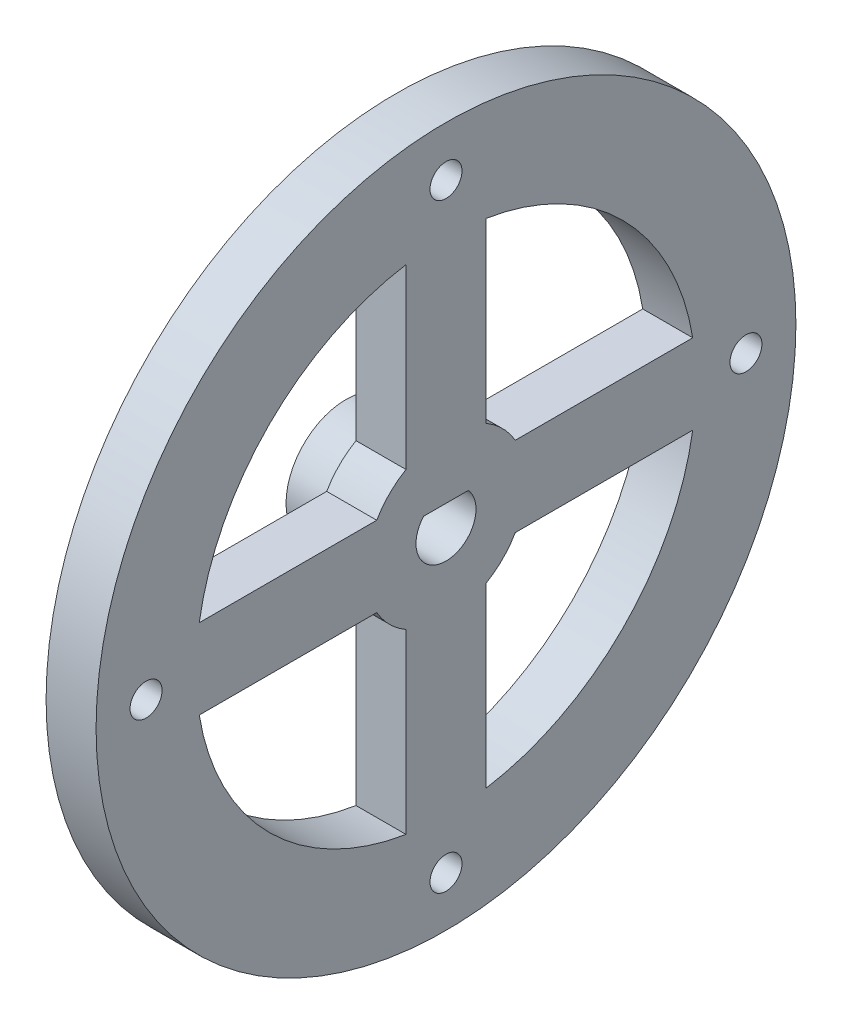
from build123d import *

# Parameters (mm, degrees)
SKETCH1_R           = 35
BOSS_EXTRUDE1_DEPTH = 5
SKETCH2_R           = 1.6
CUT_EXTRUDE1_DEPTH  = 50.749371855
BOSS_EXTRUDE2_START = 5
SKETCH3_R           = 6
BOSS_EXTRUDE2_DEPTH = 5
SKETCH6_R           = 3
CUT_EXTRUDE2_DEPTH  = 2
CUT_EXTRUDE3_DEPTH  = 2.3876


with BuildPart() as part:
    # Sketch1 → Boss-Extrude1 (new body)
    with BuildSketch(Plane(origin=(0, 0, 0), x_dir=(0, 0, -1), z_dir=(1, 0, 0))):
        Circle(SKETCH1_R)
        with BuildLine():
            Line((4, 6.92820323), (4, 24.677925359))
            ThreePointArc((4, 24.677925359), (17.67766953, 17.67766953), (24.677925359, 4))
            Line((24.677925359, 4), (6.92820323, 4))
            ThreePointArc((6.92820323, 4), (5.656854249, 5.656854249), (4, 6.92820323))
        make_face(mode=Mode.SUBTRACT)
        with BuildLine():
            Line((-4, 24.677925359), (-4, 6.92820323))
            ThreePointArc((-4, 6.92820323), (-5.656854249, 5.656854249), (-6.92820323, 4))
            Line((-6.92820323, 4), (-24.677925359, 4))
            ThreePointArc((-24.677925359, 4), (-17.67766953, 17.67766953), (-4, 24.677925359))
        make_face(mode=Mode.SUBTRACT)
        with BuildLine():
            Line((-24.677925359, -4), (-6.92820323, -4))
            ThreePointArc((-6.92820323, -4), (-5.656854249, -5.656854249), (-4, -6.92820323))
            Line((-4, -6.92820323), (-4, -24.677925359))
            ThreePointArc((-4, -24.677925359), (-17.67766953, -17.67766953), (-24.677925359, -4))
        make_face(mode=Mode.SUBTRACT)
        with BuildLine():
            Line((4, -24.677925359), (4, -6.92820323))
            ThreePointArc((4, -6.92820323), (5.656854249, -5.656854249), (6.92820323, -4))
            Line((6.92820323, -4), (24.677925359, -4))
            ThreePointArc((24.677925359, -4), (17.67766953, -17.67766953), (4, -24.677925359))
        make_face(mode=Mode.SUBTRACT)
        with BuildLine():
            Line((2.236067977, 2), (-2.236067977, 2))
            ThreePointArc((-2.236067977, 2), (0, -3), (2.236067977, 2))
        make_face(mode=Mode.SUBTRACT)
    extrude(amount=BOSS_EXTRUDE1_DEPTH)

    # Sketch2 → Cut-Extrude1 (cut, through all)
    with BuildSketch(Plane.ZY):
        with Locations((0, 30)):
            Circle(SKETCH2_R)
        with Locations((30, 0)):
            Circle(SKETCH2_R)
        with Locations((0, -30)):
            Circle(SKETCH2_R)
        with Locations((-30, 0)):
            Circle(SKETCH2_R)
    extrude(amount=-CUT_EXTRUDE1_DEPTH, mode=Mode.SUBTRACT)

    # Sketch3 → Boss-Extrude2 (add)
    with BuildSketch(Plane.ZY.offset(BOSS_EXTRUDE2_START)):
        Circle(SKETCH3_R)
        with BuildLine():
            Line((-2.236067977, 2), (2.236067977, 2))
            ThreePointArc((2.236067977, 2), (0, -3), (-2.236067977, 2))
        make_face(mode=Mode.SUBTRACT)
    extrude(amount=-BOSS_EXTRUDE2_DEPTH)

    # Sketch6 → Cut-Extrude2 (cut)
    with BuildSketch(Plane.ZY):
        with Locations((0, 30)):
            Circle(SKETCH6_R)
        with Locations((30, 0)):
            Circle(SKETCH6_R)
        with Locations((0, -30)):
            Circle(SKETCH6_R)
        with Locations((-30, 0)):
            Circle(SKETCH6_R)
    extrude(amount=-CUT_EXTRUDE2_DEPTH, mode=Mode.SUBTRACT)

    # Sketch7 → Cut-Extrude3 (cut)
    with BuildSketch(Plane.ZY.offset(5)):
        with BuildLine():
            Line((-3.9116, -3.300656457), (-3.9116, 3.300656457))
            ThreePointArc((-3.9116, 3.300656457), (0, 5.1181), (3.9116, 3.300656457))
            Line((3.9116, 3.300656457), (3.9116, -3.300656457))
            ThreePointArc((3.9116, -3.300656457), (0, -5.1181), (-3.9116, -3.300656457))
        make_face()
    extrude(amount=-CUT_EXTRUDE3_DEPTH, mode=Mode.SUBTRACT)


solid = part.part
